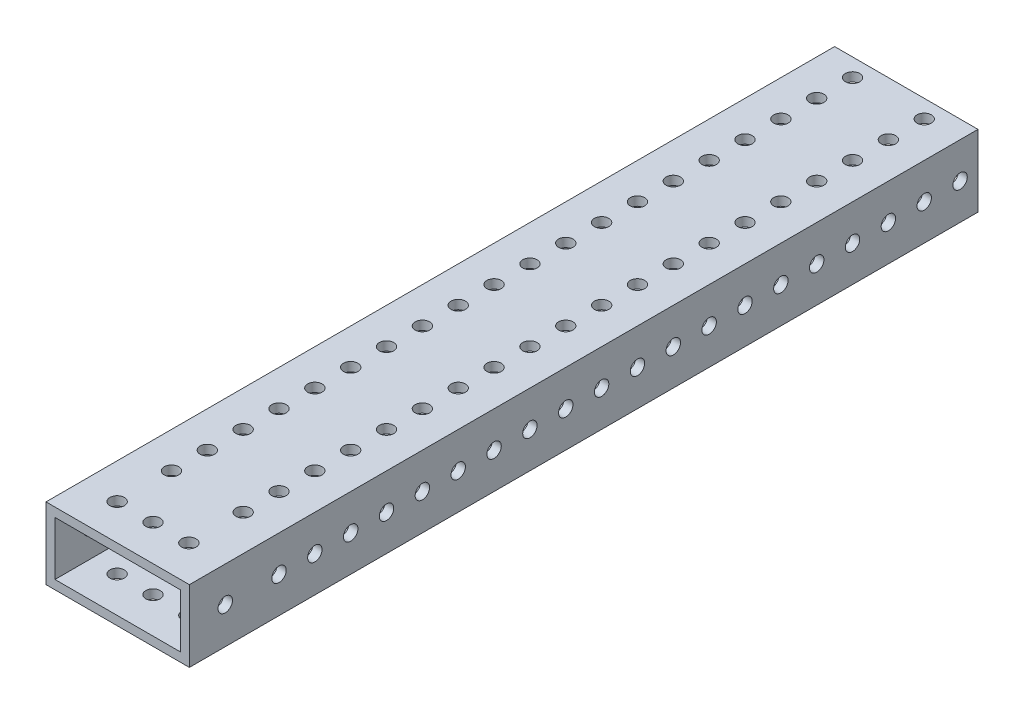
from build123d import *

# Parameters (mm, degrees)
SKETCH1_W           = 50.8
SKETCH1_H           = 279.4
BOSS_EXTRUDE1_DEPTH = 25.4
SKETCH2_W           = 44.45
SKETCH2_H           = 19.05
CUT_EXTRUDE1_DEPTH  = 286.114292872
SKETCH4_R           = 2.5527
CUT_EXTRUDE2_DEPTH  = 286.114292872
SKETCH5_R           = 2.5527
CUT_EXTRUDE3_DEPTH  = 286.114292872


with BuildPart() as part:
    # Sketch1 → Boss-Extrude1 (new body)
    with BuildSketch(Plane(origin=(0, 0, 0), x_dir=(1, 0, 0), z_dir=(0, 1, 0))):
        with Locations((25.4, 139.7)):
            Rectangle(SKETCH1_W, SKETCH1_H)
    extrude(amount=BOSS_EXTRUDE1_DEPTH)

    # Sketch2 → Cut-Extrude1 (cut, through all)
    with BuildSketch(Plane.XY):
        with Locations((25.4, 12.7)):
            Rectangle(SKETCH2_W, SKETCH2_H)
    extrude(amount=-CUT_EXTRUDE1_DEPTH, mode=Mode.SUBTRACT)

    # Sketch4 → Cut-Extrude2 (cut, through all)
    with BuildSketch(Plane(origin=(0, 25.4, 0), x_dir=(1, 0, 0), z_dir=(0, 1, 0))):
        with Locations((12.7, 31.75)):
            Circle(SKETCH4_R)
        with Locations((38.1, 31.75)):
            Circle(SKETCH4_R)
        with Locations((12.7, 44.45)):
            Circle(SKETCH4_R)
        with Locations((38.1, 44.45)):
            Circle(SKETCH4_R)
        with Locations((12.7, 57.15)):
            Circle(SKETCH4_R)
        with Locations((38.1, 57.15)):
            Circle(SKETCH4_R)
        with Locations((12.7, 69.85)):
            Circle(SKETCH4_R)
        with Locations((38.1, 69.85)):
            Circle(SKETCH4_R)
        with Locations((12.7, 82.55)):
            Circle(SKETCH4_R)
        with Locations((38.1, 82.55)):
            Circle(SKETCH4_R)
        with Locations((12.7, 95.25)):
            Circle(SKETCH4_R)
        with Locations((38.1, 95.25)):
            Circle(SKETCH4_R)
        with Locations((12.7, 107.95)):
            Circle(SKETCH4_R)
        with Locations((38.1, 107.95)):
            Circle(SKETCH4_R)
        with Locations((12.7, 120.65)):
            Circle(SKETCH4_R)
        with Locations((38.1, 120.65)):
            Circle(SKETCH4_R)
        with Locations((12.7, 133.35)):
            Circle(SKETCH4_R)
        with Locations((38.1, 133.35)):
            Circle(SKETCH4_R)
        with Locations((12.7, 146.05)):
            Circle(SKETCH4_R)
        with Locations((38.1, 146.05)):
            Circle(SKETCH4_R)
        with Locations((12.7, 158.75)):
            Circle(SKETCH4_R)
        with Locations((38.1, 158.75)):
            Circle(SKETCH4_R)
        with Locations((12.7, 171.45)):
            Circle(SKETCH4_R)
        with Locations((38.1, 171.45)):
            Circle(SKETCH4_R)
        with Locations((12.7, 184.15)):
            Circle(SKETCH4_R)
        with Locations((38.1, 184.15)):
            Circle(SKETCH4_R)
        with Locations((12.7, 196.85)):
            Circle(SKETCH4_R)
        with Locations((38.1, 196.85)):
            Circle(SKETCH4_R)
        with Locations((12.7, 209.55)):
            Circle(SKETCH4_R)
        with Locations((38.1, 209.55)):
            Circle(SKETCH4_R)
        with Locations((12.7, 222.25)):
            Circle(SKETCH4_R)
        with Locations((38.1, 222.25)):
            Circle(SKETCH4_R)
        with Locations((12.7, 234.95)):
            Circle(SKETCH4_R)
        with Locations((38.1, 234.95)):
            Circle(SKETCH4_R)
        with Locations((12.7, 247.65)):
            Circle(SKETCH4_R)
        with Locations((38.1, 247.65)):
            Circle(SKETCH4_R)
        with Locations((12.7, 260.35)):
            Circle(SKETCH4_R)
        with Locations((38.1, 260.35)):
            Circle(SKETCH4_R)
        with Locations((12.7, 273.05)):
            Circle(SKETCH4_R)
        with Locations((38.1, 273.05)):
            Circle(SKETCH4_R)
        with Locations((12.7, 285.75)):
            Circle(SKETCH4_R)
        with Locations((38.1, 285.75)):
            Circle(SKETCH4_R)
        with Locations((12.7, 298.45)):
            Circle(SKETCH4_R)
        with Locations((38.1, 298.45)):
            Circle(SKETCH4_R)
        with Locations((12.7, 311.15)):
            Circle(SKETCH4_R)
        with Locations((38.1, 311.15)):
            Circle(SKETCH4_R)
        with Locations((12.7, 323.85)):
            Circle(SKETCH4_R)
        with Locations((38.1, 323.85)):
            Circle(SKETCH4_R)
        with Locations((12.7, 336.55)):
            Circle(SKETCH4_R)
        with Locations((38.1, 336.55)):
            Circle(SKETCH4_R)
        with Locations((12.7, 349.25)):
            Circle(SKETCH4_R)
        with Locations((38.1, 349.25)):
            Circle(SKETCH4_R)
        with Locations((12.7, 361.95)):
            Circle(SKETCH4_R)
        with Locations((38.1, 361.95)):
            Circle(SKETCH4_R)
        with Locations((12.7, 374.65)):
            Circle(SKETCH4_R)
        with Locations((38.1, 374.65)):
            Circle(SKETCH4_R)
        with Locations((12.7, 387.35)):
            Circle(SKETCH4_R)
        with Locations((38.1, 387.35)):
            Circle(SKETCH4_R)
        with Locations((12.7, 400.05)):
            Circle(SKETCH4_R)
        with Locations((38.1, 400.05)):
            Circle(SKETCH4_R)
        with Locations((12.7, 412.75)):
            Circle(SKETCH4_R)
        with Locations((38.1, 412.75)):
            Circle(SKETCH4_R)
        with Locations((12.7, 425.45)):
            Circle(SKETCH4_R)
        with Locations((38.1, 425.45)):
            Circle(SKETCH4_R)
        with Locations((12.7, 438.15)):
            Circle(SKETCH4_R)
        with Locations((38.1, 438.15)):
            Circle(SKETCH4_R)
        with Locations((12.7, 450.85)):
            Circle(SKETCH4_R)
        with Locations((38.1, 450.85)):
            Circle(SKETCH4_R)
        with Locations((12.7, 463.55)):
            Circle(SKETCH4_R)
        with Locations((38.1, 463.55)):
            Circle(SKETCH4_R)
        with Locations((12.7, 476.25)):
            Circle(SKETCH4_R)
        with Locations((38.1, 476.25)):
            Circle(SKETCH4_R)
        with Locations((12.7, 488.95)):
            Circle(SKETCH4_R)
        with Locations((38.1, 488.95)):
            Circle(SKETCH4_R)
        with Locations((12.7, 501.65)):
            Circle(SKETCH4_R)
        with Locations((38.1, 501.65)):
            Circle(SKETCH4_R)
        with Locations((12.5095, 12.7)):
            Circle(SKETCH4_R)
        with Locations((25.2095, 12.7)):
            Circle(SKETCH4_R)
        with Locations((37.9095, 12.7)):
            Circle(SKETCH4_R)
    extrude(amount=-CUT_EXTRUDE2_DEPTH, mode=Mode.SUBTRACT)

    # Sketch5 → Cut-Extrude3 (cut, through all)
    with BuildSketch(Plane.ZY):
        with Locations((-31.75, 12.7)):
            Circle(SKETCH5_R)
        with Locations((-44.45, 12.7)):
            Circle(SKETCH5_R)
        with Locations((-57.15, 12.7)):
            Circle(SKETCH5_R)
        with Locations((-69.85, 12.7)):
            Circle(SKETCH5_R)
        with Locations((-82.55, 12.7)):
            Circle(SKETCH5_R)
        with Locations((-95.25, 12.7)):
            Circle(SKETCH5_R)
        with Locations((-107.95, 12.7)):
            Circle(SKETCH5_R)
        with Locations((-120.65, 12.7)):
            Circle(SKETCH5_R)
        with Locations((-133.35, 12.7)):
            Circle(SKETCH5_R)
        with Locations((-146.05, 12.7)):
            Circle(SKETCH5_R)
        with Locations((-158.75, 12.7)):
            Circle(SKETCH5_R)
        with Locations((-171.45, 12.7)):
            Circle(SKETCH5_R)
        with Locations((-184.15, 12.7)):
            Circle(SKETCH5_R)
        with Locations((-196.85, 12.7)):
            Circle(SKETCH5_R)
        with Locations((-209.55, 12.7)):
            Circle(SKETCH5_R)
        with Locations((-222.25, 12.7)):
            Circle(SKETCH5_R)
        with Locations((-234.95, 12.7)):
            Circle(SKETCH5_R)
        with Locations((-247.65, 12.7)):
            Circle(SKETCH5_R)
        with Locations((-260.35, 12.7)):
            Circle(SKETCH5_R)
        with Locations((-273.05, 12.7)):
            Circle(SKETCH5_R)
        with Locations((-285.75, 12.7)):
            Circle(SKETCH5_R)
        with Locations((-298.45, 12.7)):
            Circle(SKETCH5_R)
        with Locations((-311.15, 12.7)):
            Circle(SKETCH5_R)
        with Locations((-323.85, 12.7)):
            Circle(SKETCH5_R)
        with Locations((-336.55, 12.7)):
            Circle(SKETCH5_R)
        with Locations((-349.25, 12.7)):
            Circle(SKETCH5_R)
        with Locations((-361.95, 12.7)):
            Circle(SKETCH5_R)
        with Locations((-374.65, 12.7)):
            Circle(SKETCH5_R)
        with Locations((-387.35, 12.7)):
            Circle(SKETCH5_R)
        with Locations((-400.05, 12.7)):
            Circle(SKETCH5_R)
        with Locations((-412.75, 12.7)):
            Circle(SKETCH5_R)
        with Locations((-425.45, 12.7)):
            Circle(SKETCH5_R)
        with Locations((-438.15, 12.7)):
            Circle(SKETCH5_R)
        with Locations((-450.85, 12.7)):
            Circle(SKETCH5_R)
        with Locations((-463.55, 12.7)):
            Circle(SKETCH5_R)
        with Locations((-476.25, 12.7)):
            Circle(SKETCH5_R)
        with Locations((-488.95, 12.7)):
            Circle(SKETCH5_R)
        with Locations((-501.65, 12.7)):
            Circle(SKETCH5_R)
        with Locations((-12.7, 12.954)):
            Circle(SKETCH5_R)
    extrude(amount=-CUT_EXTRUDE3_DEPTH, mode=Mode.SUBTRACT)


solid = part.part
